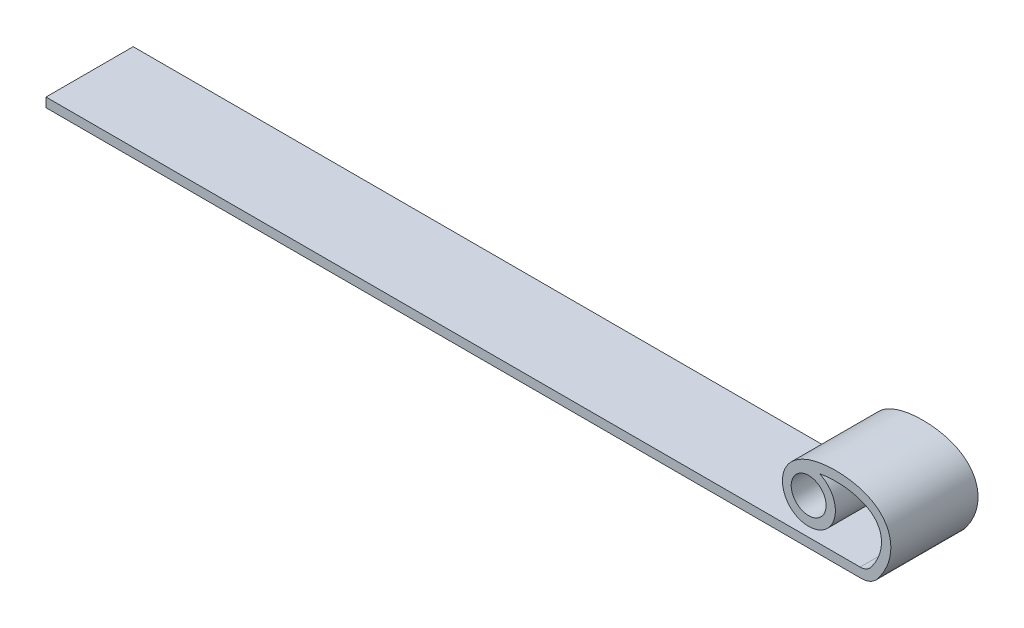
from build123d import *

# Parameters (mm, degrees)
SKETCH1_W               = 127
SKETCH1_H               = 9.525
BOSS_EXTRUDE1_DEPTH     = 1.016
BOSS_EXTRUDE6_START     = -9.525
BOSS_EXTRUDE6_OUTLINE_R = 1.905
BOSS_EXTRUDE6_DEPTH     = 9.525
SKETCH9_W               = 36.03828532
SKETCH9_H               = 1.016
CUT_EXTRUDE1_DEPTH      = 65.812462184
FILLET1_R               = 1.524
FILLET2_R               = 2.286


# Read off the part's stored shape, not the designer's step: Boss-Extrude6
with BuildPart() as part:
    # Sketch1 → Boss-Extrude1 (new body)
    with BuildSketch(Plane(origin=(0, 0, 0), x_dir=(1, 0, 0), z_dir=(0, 1, 0))):
        Rectangle(SKETCH1_W, SKETCH1_H)
    extrude(amount=BOSS_EXTRUDE1_DEPTH)

    # Boss-Extrude6 outline → Boss-Extrude6 (add)
    with BuildSketch(Plane.XY.offset(4.7625).offset(BOSS_EXTRUDE6_START)):
        with BuildLine():
            add(Edge.make_bspline(
                [(26.156419395, 1.016), (27.757434641, 2.825849187), (28.350180328, 4.564407662), (28.120667146, 5.896063841), (27.39467414, 6.780008349), (26.424210355, 7.324865414), (25.33727298, 7.653728665), (24.19871737, 7.837160052), (23.061378829, 7.895254529), (21.981011381, 7.826483038), (21.009951357, 7.632249789)],
                knots=[0, 0, 0, 0, 0, 0, 0, 0, 0, 0, 0, 0.472115693, 0.472115693, 0.472115693, 0.472115693, 0.472115693, 0.472115693, 0.472115693, 0.472115693, 0.472115693, 0.472115693, 0.472115693], degree=10))
            Line((26.156419395, 1.016), (27.46171468, 1.016))
            add(Edge.make_bspline(
                [(27.46171468, 1.016), (27.623905569, 1.236289395), (28.056884434, 1.889074198), (28.557724419, 2.962290085), (28.8172552, 4.180611411), (28.76040826, 5.30661561), (28.416603121, 6.290511823), (27.666181069, 7.348770574), (26.417551122, 8.178142562), (24.81092103, 8.664788271), (22.918485913, 8.872514854), (21.352995968, 8.76504205), (19.444164003, 8.313268155), (17.998494366, 7.538133432), (17.083415516, 6.10416322), (16.87715717, 4.944774701), (17.068356899, 3.924752178), (17.486556032, 3.160303311), (17.876833308, 2.766163414), (18.127748015, 2.578126084), (18.193760769, 2.534731904), (18.235229403, 2.508279507)],
                knots=[0.015823115, 0.015823115, 0.015823115, 0.015823115, 0.03125, 0.0625, 0.09375, 0.125, 0.15625, 0.1875, 0.25, 0.3125, 0.375, 0.469264357, 0.500514357, 0.625, 0.6875, 0.75, 0.8125, 0.875, 0.9375, 0.96875, 1, 1, 1, 1], degree=3))
            ThreePointArc((18.235229403, 2.508279507), (22.374991172, 3.579790176), (21.009951357, 7.632249789))
        make_face()
        with Locations((19.806419395, 4.970717934)):
            Circle(BOSS_EXTRUDE6_OUTLINE_R, mode=Mode.SUBTRACT)
    extrude(amount=BOSS_EXTRUDE6_DEPTH)

    # Sketch9 → Cut-Extrude1 (cut, through all)
    with BuildSketch(Plane.XY.offset(4.7625)):
        with Locations((45.48085734, 0.508)):
            Rectangle(SKETCH9_W, SKETCH9_H)
    extrude(amount=-CUT_EXTRUDE1_DEPTH, mode=Mode.SUBTRACT)

    # Fillet1
    fillet1_edges = [part.edges().sort_by_distance(p)[0] for p in [
        (26.156419395, 1.016, 0),
    ]]
    fillet(fillet1_edges, radius=FILLET1_R)

    # Fillet2
    # the kernel refuses this fillet: 2.286 mm, written as the material it takes off along each edge
    with BuildSketch(Plane(origin=(27.46171468, 0, 9.51440488), x_dir=(4.5999599579907773e-10, 1.0, 0), z_dir=(0, 0, -1))) as fillet2_piece_1:
        with BuildLine():
            CenterArc((2.285999999, -1.900761953), FILLET2_R, 123.748988569, 56.251011404)
            Line((-1e-09, -1.900761952), (-0.045720001, -1.900761952))
            Line((-0.045720001, -1.900761952), (-0.04572, 0))
            Line((-0.04572, 0), (0, 0.04572))
            ThreePointArc((0, 0.04572), (0.508, 0.04572), (0.9906, 0.038015239))
            Line((0.9906, 0.038015239), (1.016, 0))
        make_face()
    extrude(amount=19.02880976, mode=Mode.SUBTRACT)


solid = part.part
